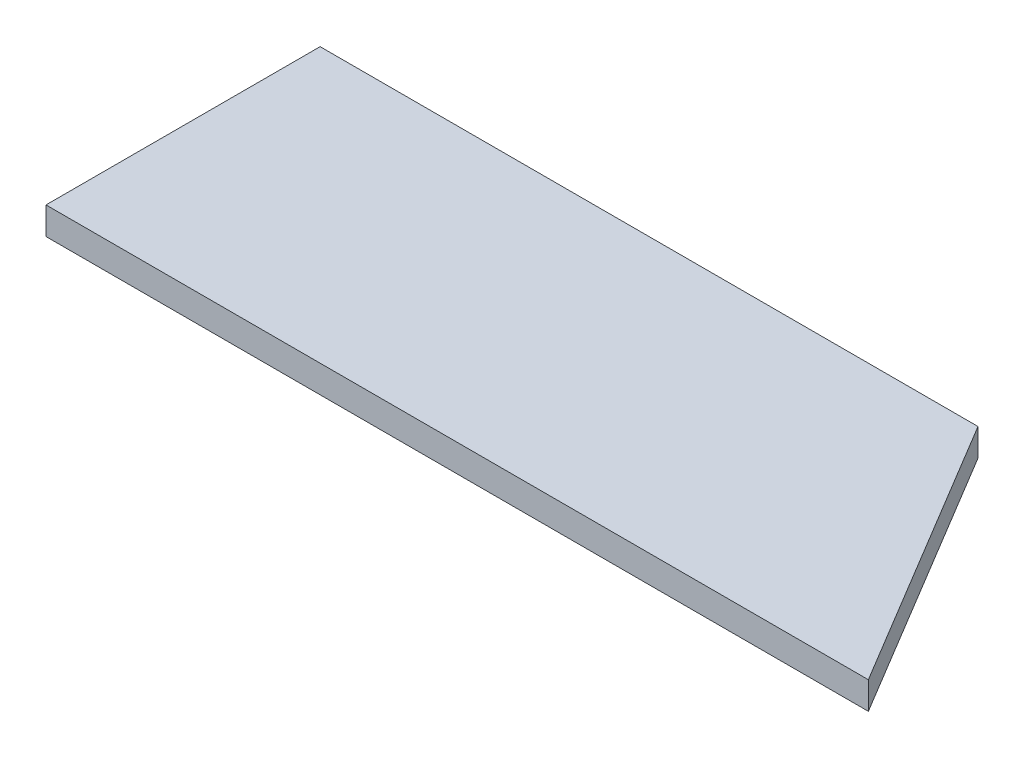
from build123d import *

# Parameters (mm, degrees)
EXTRUDE_1_DEPTH = 5


with BuildPart() as part:
    # Эскиз1 → Бобышка-Вытянуть1 (new body)
    with BuildSketch(Plane(origin=(0, 0, 0), x_dir=(1, 0, 0), z_dir=(0, 1, 0))):
        Polygon((0, 0), (150, 0), (120, 50), (0, 50), align=None)
    extrude(amount=EXTRUDE_1_DEPTH)


solid = part.part
